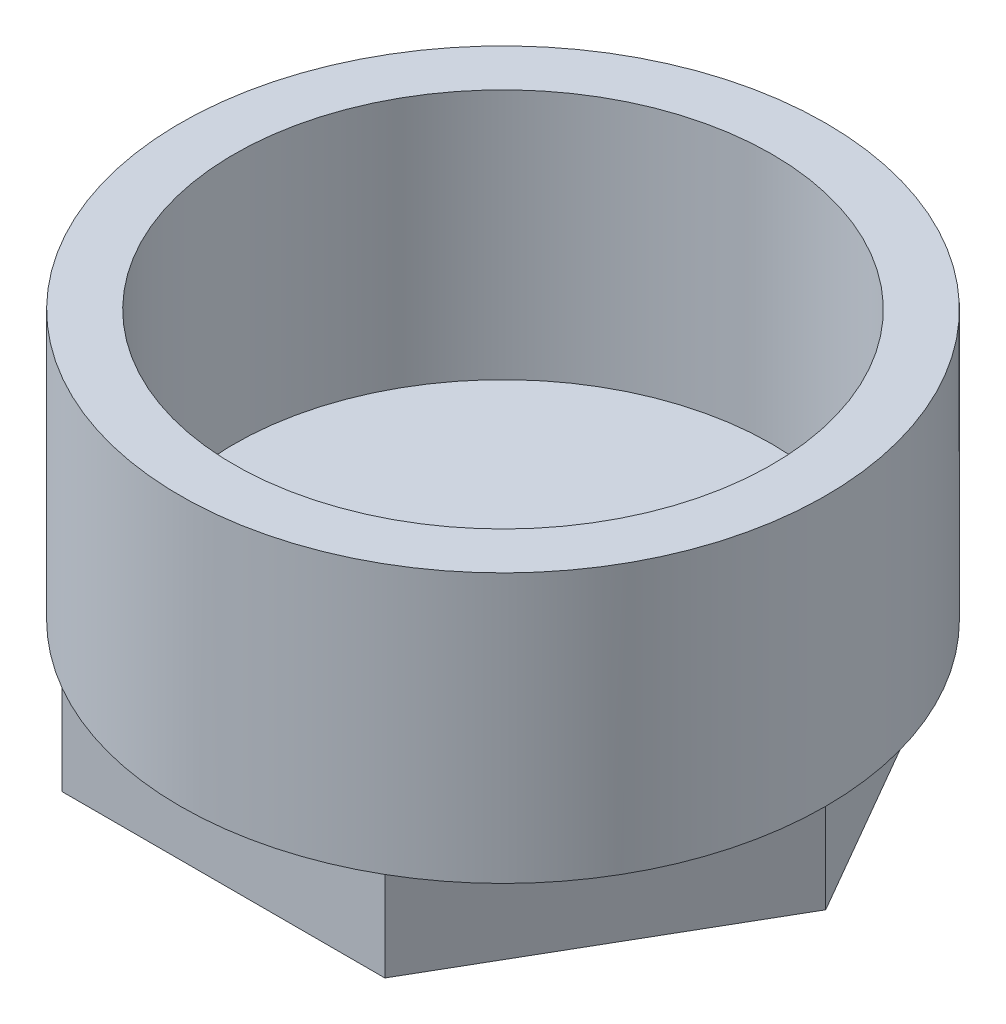
from build123d import *

# Parameters (mm, degrees)
SCHIZZO2_R               = 1.585
TAGLIO_ESTRUSIONE1_DEPTH = 10
TAGLIO_ESTRUSIONE2_START = -5
TAGLIO_ESTRUSIONE2_DEPTH = 5


with BuildPart() as part:
    # Schizzo1 → Rivoluzione1 (revolve)
    with BuildSketch(Plane.XY):
        Polygon((0, 0), (-18, 0), (-18, 20), (-15, 20), (-15, 6), (0, 6), align=None)
    revolve(axis=Axis((0, 0, 0), (0, 1, 0)))

    # Schizzo2 → Taglio-Estrusione1 (cut)
    with BuildSketch(Plane.XZ):
        Circle(SCHIZZO2_R)
    extrude(amount=-TAGLIO_ESTRUSIONE1_DEPTH, mode=Mode.SUBTRACT)

    # Schizzo5 → Taglio-Estrusione2 (cut)
    with BuildSketch(Plane(origin=(0, 0, 0), x_dir=(-1, 0, 0), z_dir=(0, -1, 0)).offset(TAGLIO_ESTRUSIONE2_START)):
        with BuildLine():
            ThreePointArc((18, 0), (15.588457268, 9), (9, 15.588457268))
            Line((9, 15.588457268), (18, 0))
        make_face()
        with BuildLine():
            Line((-9, 15.588457268), (9, 15.588457268))
            ThreePointArc((9, 15.588457268), (0, 18), (-9, 15.588457268))
        make_face()
        with BuildLine():
            ThreePointArc((9, -15.588457268), (15.588457268, -9), (18, 0))
            Line((18, 0), (9, -15.588457268))
        make_face()
        with BuildLine():
            Line((-18, 0), (-9, 15.588457268))
            ThreePointArc((-9, 15.588457268), (-15.588457268, 9), (-18, 0))
        make_face()
        with BuildLine():
            ThreePointArc((-9, -15.588457268), (0, -18), (9, -15.588457268))
            Line((9, -15.588457268), (-9, -15.588457268))
        make_face()
        with BuildLine():
            Line((-9, -15.588457268), (-18, 0))
            ThreePointArc((-18, 0), (-15.588457268, -9), (-9, -15.588457268))
        make_face()
    extrude(amount=TAGLIO_ESTRUSIONE2_DEPTH, mode=Mode.SUBTRACT)


solid = part.part
